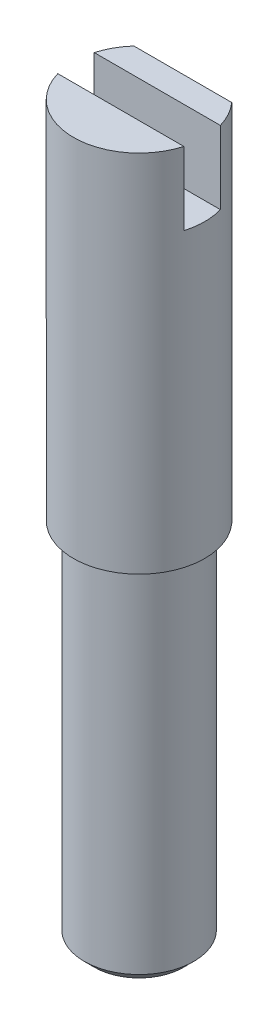
from build123d import *

# Parameters (mm, degrees)
BOSS_EXTRUDE1_DEPTH = 10
SKETCH2_W           = 5
SKETCH2_H           = 1
CUT_EXTRUDE1_DEPTH  = 2
SKETCH3_R           = 1.6
BOSS_EXTRUDE2_DEPTH = 10


# Read off the part's stored shape, not the designer's step: M3 Machine Threads Stud1
with BuildPart() as part:
    # Sketch1 → Boss-Extrude1 (new body)
    with BuildSketch(Plane(origin=(0, 0, 0), x_dir=(1, 0, 0), z_dir=(0, 1, 0))):
        with BuildLine():
            Line((-1.341640786, 1.2), (1.341640786, 1.2))
            ThreePointArc((1.341640786, 1.2), (0, -1.8), (-1.341640786, 1.2))
        make_face()
    extrude(amount=BOSS_EXTRUDE1_DEPTH)

    # Sketch2 → Cut-Extrude1 (cut)
    with BuildSketch(Plane(origin=(0, 10, 0), x_dir=(1, 0, 0), z_dir=(0, 1, 0))):
        Rectangle(SKETCH2_W, SKETCH2_H)
    extrude(amount=-CUT_EXTRUDE1_DEPTH, mode=Mode.SUBTRACT)

    # Sketch3 → Boss-Extrude2 (add)
    with BuildSketch(Plane.XZ):
        with Locations(Location((0, 0, 0), (0, 0, 228.590377891))):
            Circle(SKETCH3_R)
    extrude(amount=BOSS_EXTRUDE2_DEPTH)

    # M3 Machine Threads Stud1 outline → M3 Machine Threads Stud1 (revolve, cut)
    with BuildSketch(Plane.XY):
        Polygon((1.6, 0), (1.5, 0), (1.5, -9.7195), (1.2195, -10), (1.6, -10), align=None)
    revolve(axis=Axis((0, 0, 0), (0, 1, 0)), mode=Mode.SUBTRACT)


solid = part.part
